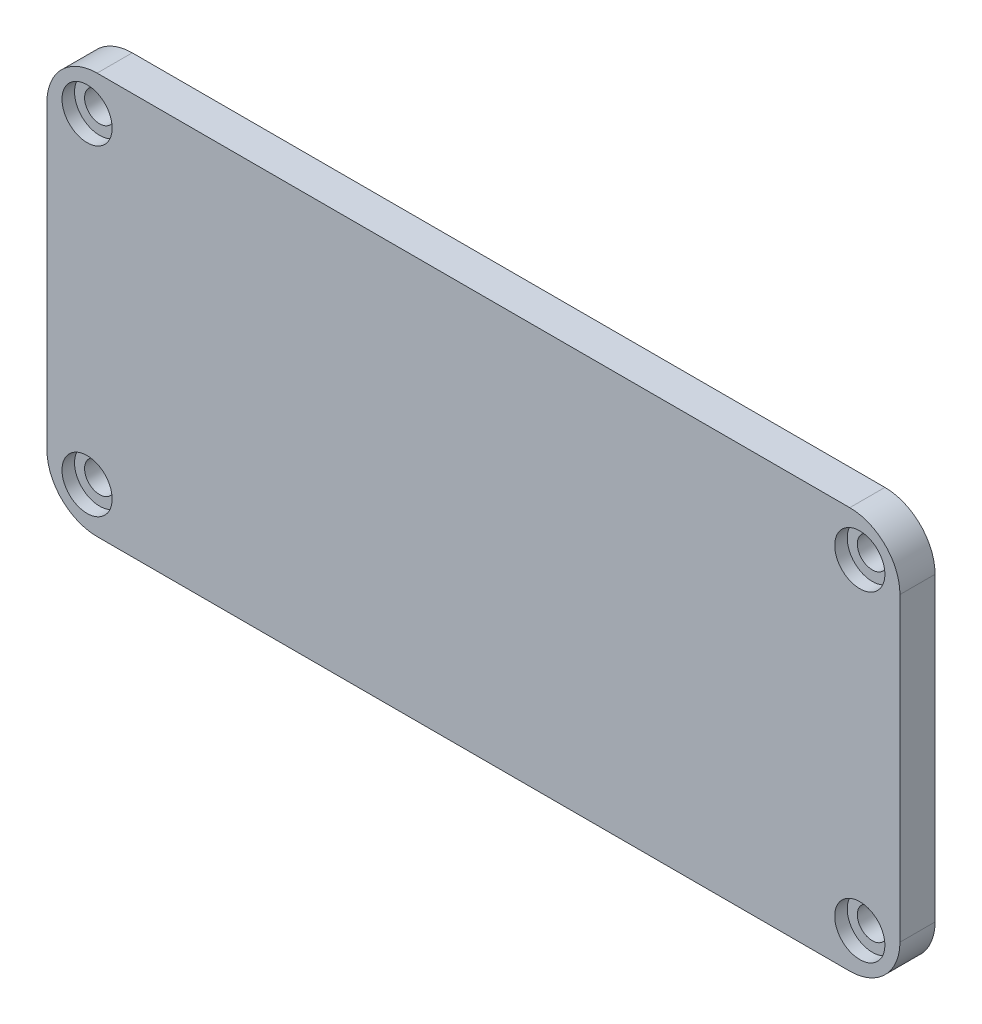
from build123d import *

# Parameters (mm, degrees)
EXTRUDE_1_DEPTH          = 7
CUT_EXTRUDE_1_DEPTH      = 39
CUT_EXTRUDE_1_DEPTH_BACK = 10
SKETCH_2_R               = 3
SKETCH_3_R               = 5
CUT_EXTRUDE_2_DEPTH      = 2.5


with BuildPart() as part:
    # 草图1 → 凸台-拉伸1 (new body)
    with BuildSketch(Plane.XY):
        with BuildLine():
            Line((-72.574116531, 35.487390308), (77.425883469, 35.487390308))
            ThreePointArc((77.425883469, 35.487390308), (84.496951281, 32.558458119), (87.425883469, 25.487390308))
            Line((87.425883469, 25.487390308), (87.425883469, -34.512609692))
            ThreePointArc((87.425883469, -34.512609692), (84.496951281, -41.583677504), (77.425883469, -44.512609692))
            Line((77.425883469, -44.512609692), (-72.574116531, -44.512609692))
            ThreePointArc((-72.574116531, -44.512609692), (-79.645184343, -41.583677504), (-82.574116531, -34.512609692))
            Line((-82.574116531, -34.512609692), (-82.574116531, 25.487390308))
            ThreePointArc((-82.574116531, 25.487390308), (-79.645184343, 32.558458119), (-72.574116531, 35.487390308))
        make_face()
    extrude(amount=EXTRUDE_1_DEPTH)

    # 草图2 → 切除-拉伸1 (cut, two sides: drawn at the far end of the back side and taken through both)
    with BuildSketch(Plane.XY.offset(7).offset(-CUT_EXTRUDE_1_DEPTH_BACK)):
        with Locations((-74.574116531, 27.487390308)):
            Circle(SKETCH_2_R)
        with Locations((-74.574116531, -36.512609692)):
            Circle(SKETCH_2_R)
        with Locations((79.425883469, 27.487390308)):
            Circle(SKETCH_2_R)
        with Locations((79.425883469, -36.512609692)):
            Circle(SKETCH_2_R)
    extrude(amount=CUT_EXTRUDE_1_DEPTH + CUT_EXTRUDE_1_DEPTH_BACK, mode=Mode.SUBTRACT)

    # 草图3 → 切除-拉伸2 (cut)
    with BuildSketch(Plane.XY.offset(7)):
        with Locations((-74.574116531, 27.487390308)):
            Circle(SKETCH_3_R)
        with Locations((79.425883469, 27.487390308)):
            Circle(SKETCH_3_R)
        with Locations((79.425883469, -36.512609692)):
            Circle(SKETCH_3_R)
        with Locations((-74.574116531, -36.512609692)):
            Circle(SKETCH_3_R)
    extrude(amount=-CUT_EXTRUDE_2_DEPTH, mode=Mode.SUBTRACT)


solid = part.part
